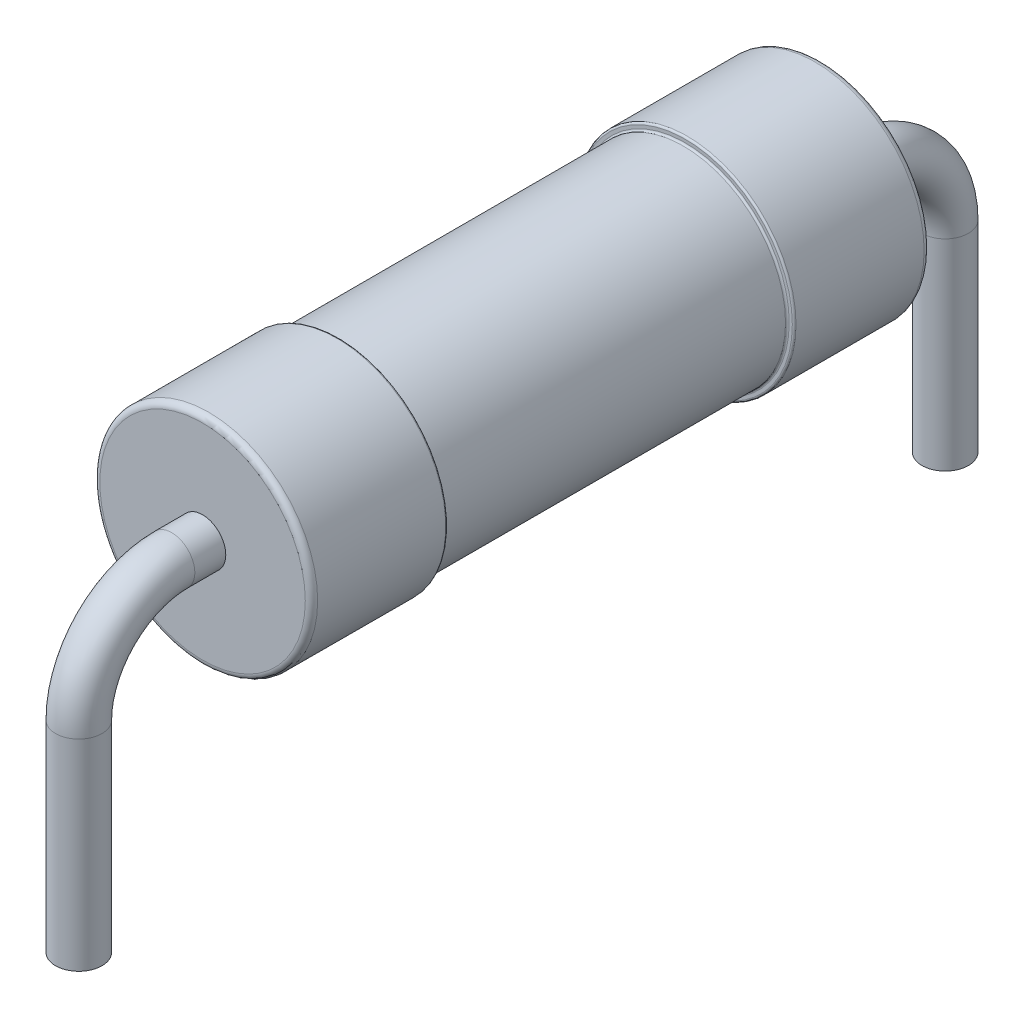
from build123d import *

# Parameters (mm, degrees)
SKETCH1_R           = 1.76
BOSS_EXTRUDE1_DEPTH = 5
SKETCH2_W           = 5.6
SKETCH2_H           = 0.946346071
FILLET1_R           = 0.1
FILLET3_R           = 0.03
SKETCH3_R           = 0.375
BOSS_EXTRUDE2_DEPTH = 5.5
SWEEP1_OUTLINE_R    = 0.375
SWEEP1_ANGLE        = 90
SWEEP1_START        = -4.75
SWEEP1_2_OUTLINE_R  = 0.375
SWEEP1_2_DEPTH      = 3.2500001
SWEEP2_OUTLINE_R    = 0.375
SWEEP2_ANGLE        = 90
SWEEP2_START        = -4.75
SWEEP2_2_OUTLINE_R  = 0.375
SWEEP2_2_DEPTH      = 3.2500001


with BuildPart() as part:
    # Sketch1 → Boss-Extrude1 (new, symmetric)
    with BuildSketch(Plane.XY):
        Circle(SKETCH1_R)
    extrude(amount=BOSS_EXTRUDE1_DEPTH, both=True)

    # Sketch2 → Cut-Revolve1 (revolve, cut)
    with BuildSketch(Plane(origin=(0, 0, 0), x_dir=(0, 0, -1), z_dir=(1, 0, 0)), mode=Mode.PRIVATE) as cut_revolve1_sk:
        with Locations((0, 2.123173036)):
            Rectangle(SKETCH2_W, SKETCH2_H)
    revolve(cut_revolve1_sk.sketch.rotate(Axis((0, 0, 6.400463156), (0, 0, -1)), 90), axis=Axis((0, 0, 6.400463156), (0, 0, -1)), mode=Mode.SUBTRACT)

    # Fillet1
    fillet1_edges = [part.edges().sort_by_distance(p)[0] for p in [
        (-1.76, 0, -5),
        (-1.76, 0, 5),
    ]]
    fillet(fillet1_edges, radius=FILLET1_R)

    # Fillet3
    fillet3_edges = [part.edges().sort_by_distance(p)[0] for p in [
        (-1.65, 0, -2.8),
        (-1.76, 0, 2.8),
        (-1.65, 0, 2.8),
        (-1.76, 0, -2.8),
    ]]
    fillet(fillet3_edges, radius=FILLET3_R)

    # Sketch3 → Boss-Extrude2 (add, symmetric)
    with BuildSketch(Plane.XY):
        Circle(SKETCH3_R)
    extrude(amount=BOSS_EXTRUDE2_DEPTH, both=True)

    # Sweep1: read off the stored shape, not the designer's step
    # Sweep1 outline → Sweep1 (revolve)
    with BuildSketch(Plane(origin=(0, -1.5, 5.5), x_dir=(0, 1, 0), z_dir=(0, 0, -1))):
        with Locations((1.5, 0)):
            Circle(SWEEP1_OUTLINE_R)
    revolve(axis=Axis((0, -1.5, 5.5), (1, 0, 0)), revolution_arc=SWEEP1_ANGLE)

    # Sweep1 2 outline → Sweep1 2 (add)
    with BuildSketch(Plane(origin=(0, 0, 0), x_dir=(1, 0, 0), z_dir=(0, 1, 0)).offset(SWEEP1_START)):
        with Locations((0, -7)):
            Circle(SWEEP1_2_OUTLINE_R)
    extrude(amount=SWEEP1_2_DEPTH)

    # Sweep2: read off the stored shape, not the designer's step
    # Sweep2 outline → Sweep2 (revolve)
    with BuildSketch(Plane(origin=(0, -1.5, -5.5), x_dir=(0, 0, -1), z_dir=(0, -1, 0))):
        with Locations((1.5, 0)):
            Circle(SWEEP2_OUTLINE_R)
    revolve(axis=Axis((0, -1.5, -5.5), (1, 0, 0)), revolution_arc=SWEEP2_ANGLE)

    # Sweep2 2 outline → Sweep2 2 (add)
    with BuildSketch(Plane(origin=(0, 0, 0), x_dir=(1, 0, 0), z_dir=(0, 1, 0)).offset(SWEEP2_START)):
        with Locations((0, 7)):
            Circle(SWEEP2_2_OUTLINE_R)
    extrude(amount=SWEEP2_2_DEPTH)


solid = part.part
